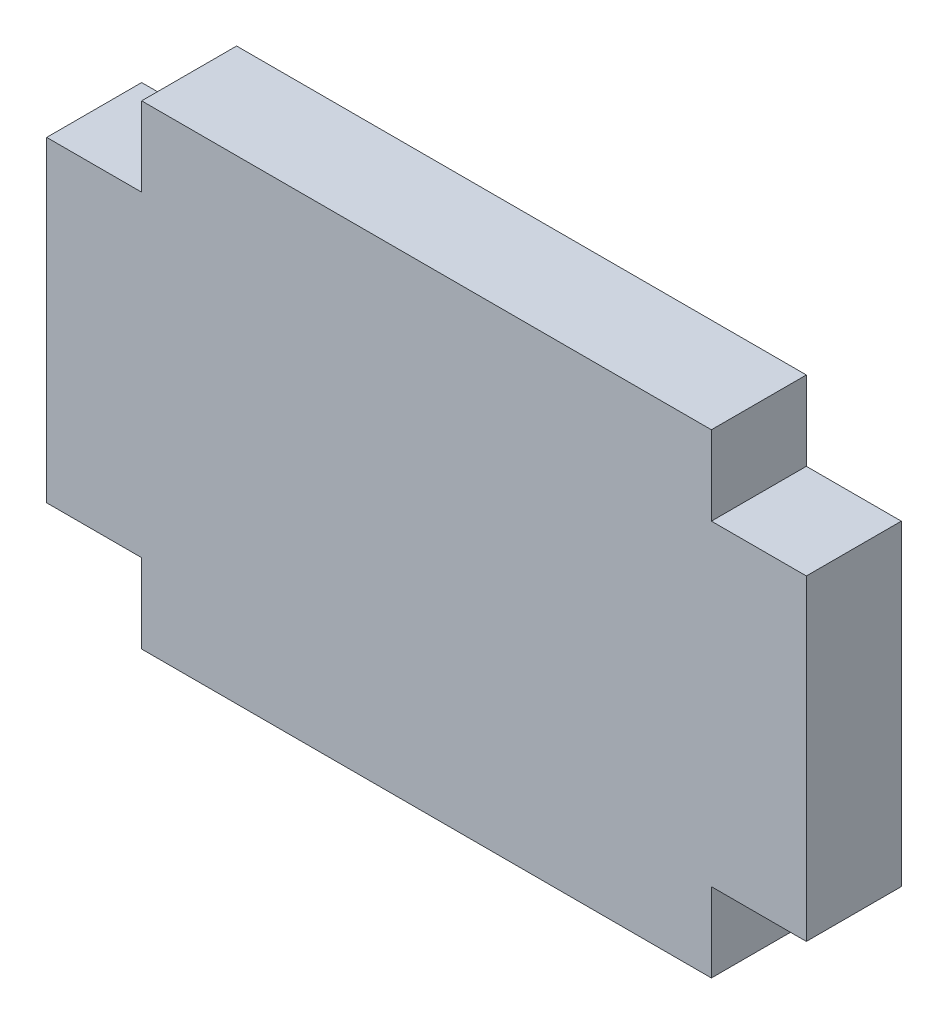
from build123d import *

# Parameters (mm, degrees)
RESSALTO_EXTRUS_O1_DEPTH = 3


with BuildPart() as part:
    # Esboço1 → Ressalto-extrusão1 (new body)
    with BuildSketch(Plane.XY):
        Polygon((-9, -5), (-9, -7.5), (9, -7.5), (9, -5), (12, -5), (12, 5), (9, 5), (9, 7.5), (-9, 7.5), (-9, 5), (-12, 5), (-12, -5), align=None)
    extrude(amount=RESSALTO_EXTRUS_O1_DEPTH)


solid = part.part
